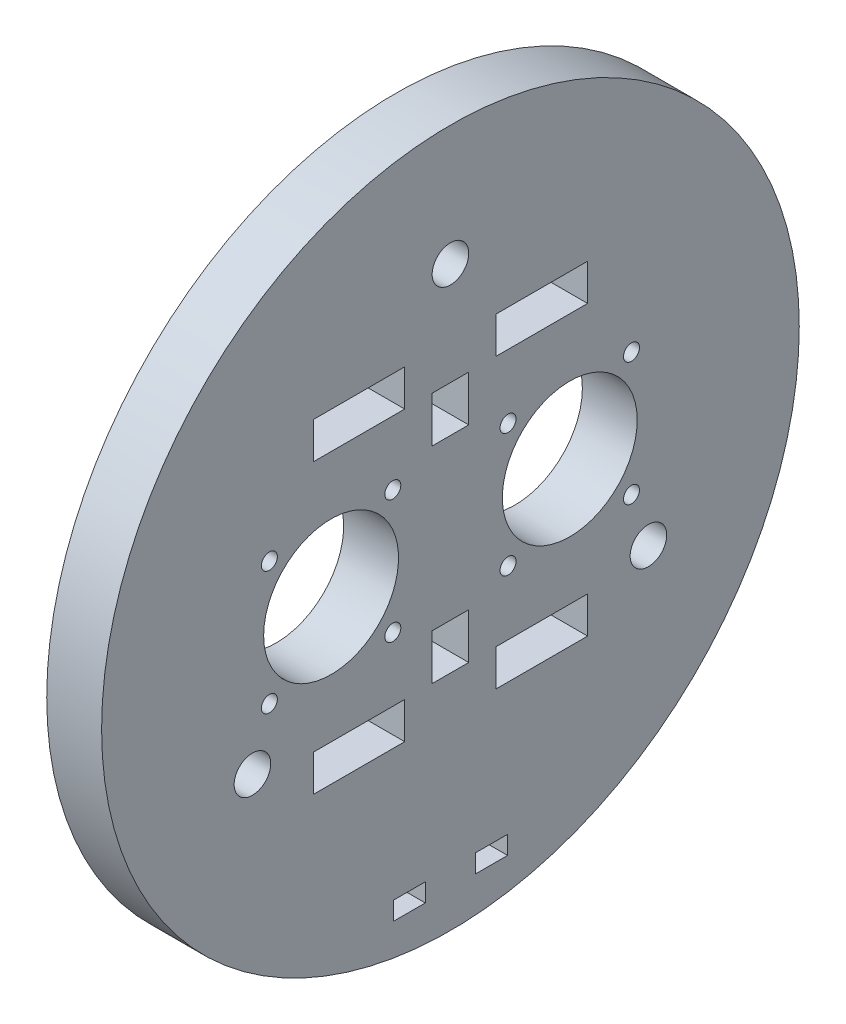
from build123d import *

# Parameters (mm, degrees)
SKETCH1_R           = 76.29
SKETCH1_R_2         = 4
SKETCH1_R_3         = 14.75
SKETCH1_R_4         = 1.75
BOSS_EXTRUDE1_DEPTH = 12
SKETCH2_W           = 20
SKETCH2_H           = 8
SKETCH2_W_2         = 8
SKETCH2_H_2         = 10
SKETCH2_W_3         = 7
SKETCH2_H_3         = 4
CUT_EXTRUDE1_DEPTH  = 8


with BuildPart() as part:
    # Sketch1 → Boss-Extrude1 (new body)
    with BuildSketch(Plane(origin=(0, 0, 0), x_dir=(0, 0, -1), z_dir=(1, 0, 0))):
        Circle(SKETCH1_R)
        with Locations((0, 50)):
            Circle(SKETCH1_R_2, mode=Mode.SUBTRACT)
        with Locations((43.301270189, -25)):
            Circle(SKETCH1_R_2, mode=Mode.SUBTRACT)
        with Locations((-43.301270189, -25)):
            Circle(SKETCH1_R_2, mode=Mode.SUBTRACT)
        with Locations((26.1, 0)):
            Circle(SKETCH1_R_3, mode=Mode.SUBTRACT)
        with Locations((-26.1, 0)):
            Circle(SKETCH1_R_3, mode=Mode.SUBTRACT)
        with Locations((39.596900686, 13.496900686)):
            Circle(SKETCH1_R_4, mode=Mode.SUBTRACT)
        with Locations((39.596900686, -13.496900686)):
            Circle(SKETCH1_R_4, mode=Mode.SUBTRACT)
        with Locations((12.603099314, -13.496900686)):
            Circle(SKETCH1_R_4, mode=Mode.SUBTRACT)
        with Locations((12.603099314, 13.496900686)):
            Circle(SKETCH1_R_4, mode=Mode.SUBTRACT)
        with Locations((-39.596900686, -13.496900686)):
            Circle(SKETCH1_R_4, mode=Mode.SUBTRACT)
        with Locations((-12.603099314, -13.496900686)):
            Circle(SKETCH1_R_4, mode=Mode.SUBTRACT)
        with Locations((-12.603099314, 13.496900686)):
            Circle(SKETCH1_R_4, mode=Mode.SUBTRACT)
        with Locations((-39.596900686, 13.496900686)):
            Circle(SKETCH1_R_4, mode=Mode.SUBTRACT)
    extrude(amount=BOSS_EXTRUDE1_DEPTH)

    # Sketch2 → Cut-Extrude1 (cut)
    with BuildSketch(Plane(origin=(12, 0, 0), x_dir=(0, 0, -1), z_dir=(1, 0, 0))):
        with Locations((20, -31.5)):
            Rectangle(SKETCH2_W, SKETCH2_H)
        with Locations((-20, -31.5)):
            Rectangle(SKETCH2_W, SKETCH2_H)
        with Locations((-20, 31.5)):
            Rectangle(SKETCH2_W, SKETCH2_H)
        with Locations((20, 31.5)):
            Rectangle(SKETCH2_W, SKETCH2_H)
        with Locations((0, -22.5)):
            Rectangle(SKETCH2_W_2, SKETCH2_H_2)
        with Locations((0, 22.5)):
            Rectangle(SKETCH2_W_2, SKETCH2_H_2)
        with Locations((-9, -66.29)):
            Rectangle(SKETCH2_W_3, SKETCH2_H_3)
        with Locations((9, -66.29)):
            Rectangle(SKETCH2_W_3, SKETCH2_H_3)
    extrude(amount=-CUT_EXTRUDE1_DEPTH, mode=Mode.SUBTRACT)


solid = part.part
